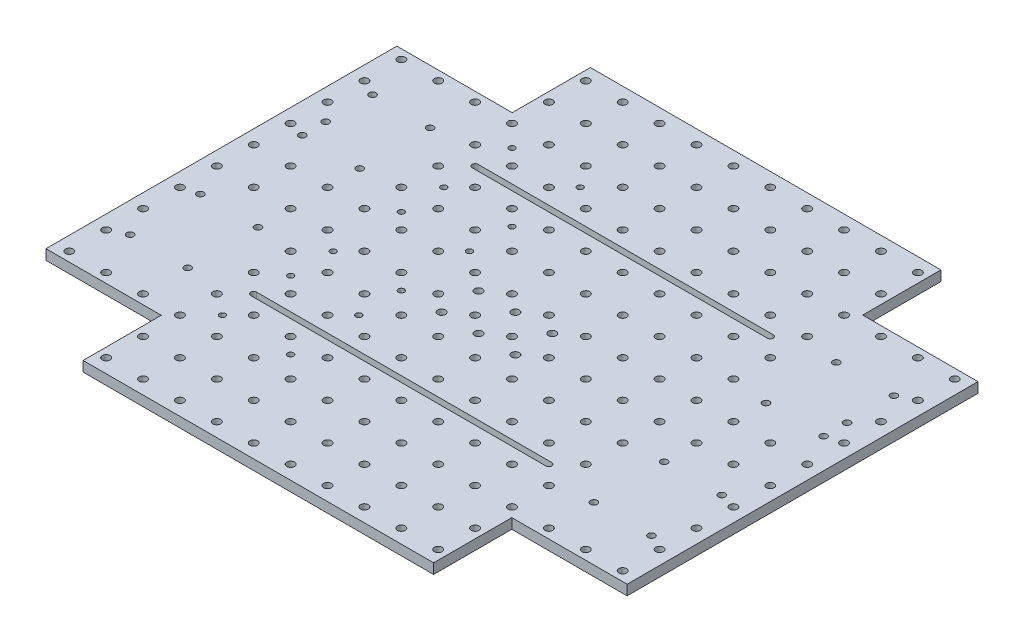
from build123d import *

# Parameters (mm, degrees)
BOSS_EXTRUDE1_DEPTH             = 5.4864
SKETCH2_R                       = 2.1
CUT_EXTRUDE1_DEPTH              = 210.1473179
F_3_0MM_CLEARANCE_DOWEL_HOLE1_D = 3.7
SKETCH5_R                       = 2.1
CUT_EXTRUDE2_DEPTH              = 210.1473179
CUT_EXTRUDE3_DEPTH              = 210.1473179
SKETCH7_R                       = 1.6
CUT_EXTRUDE4_DEPTH              = 210.1473179


with BuildPart() as part:
    # Sketch1 → Boss-Extrude1 (new body)
    with BuildSketch(Plane(origin=(0, 0, 0), x_dir=(1, 0, 0), z_dir=(0, 1, 0))):
        Polygon((95, -95.1), (157.5, -95.1), (157.5, 95.1), (95, 95.1), (95, 137.5), (-95, 137.5), (-95, 95.1), (-157.5, 95.1), (-157.5, -95.1), (-95, -95.1), (-95, -137.5), (95, -137.5), align=None)
    extrude(amount=BOSS_EXTRUDE1_DEPTH)

    # Sketch2 → Cut-Extrude1 (cut, through all)
    with BuildSketch(Plane(origin=(0, 5.4864, 0), x_dir=(1, 0, 0), z_dir=(0, 1, 0))):
        with Locations((90, -130)):
            Circle(SKETCH2_R)
        with Locations((70, -130)):
            Circle(SKETCH2_R)
        with Locations((50, -130)):
            Circle(SKETCH2_R)
        with Locations((30, -130)):
            Circle(SKETCH2_R)
        with Locations((10, -130)):
            Circle(SKETCH2_R)
        with Locations((-10, -130)):
            Circle(SKETCH2_R)
        with Locations((-30, -130)):
            Circle(SKETCH2_R)
        with Locations((-50, -130)):
            Circle(SKETCH2_R)
        with Locations((-70, -130)):
            Circle(SKETCH2_R)
        with Locations((-90, -130)):
            Circle(SKETCH2_R)
        with Locations((-110, -130)):
            Circle(SKETCH2_R)
        with Locations((90, -110)):
            Circle(SKETCH2_R)
        with Locations((70, -110)):
            Circle(SKETCH2_R)
        with Locations((50, -110)):
            Circle(SKETCH2_R)
        with Locations((30, -110)):
            Circle(SKETCH2_R)
        with Locations((10, -110)):
            Circle(SKETCH2_R)
        with Locations((-10, -110)):
            Circle(SKETCH2_R)
        with Locations((-30, -110)):
            Circle(SKETCH2_R)
        with Locations((-50, -110)):
            Circle(SKETCH2_R)
        with Locations((-70, -110)):
            Circle(SKETCH2_R)
        with Locations((-90, -110)):
            Circle(SKETCH2_R)
        with Locations((-110, -110)):
            Circle(SKETCH2_R)
        with Locations((150, -90)):
            Circle(SKETCH2_R)
        with Locations((130, -90)):
            Circle(SKETCH2_R)
        with Locations((110, -90)):
            Circle(SKETCH2_R)
        with Locations((90, -90)):
            Circle(SKETCH2_R)
        with Locations((70, -90)):
            Circle(SKETCH2_R)
        with Locations((50, -90)):
            Circle(SKETCH2_R)
        with Locations((30, -90)):
            Circle(SKETCH2_R)
        with Locations((10, -90)):
            Circle(SKETCH2_R)
        with Locations((-10, -90)):
            Circle(SKETCH2_R)
        with Locations((-30, -90)):
            Circle(SKETCH2_R)
        with Locations((-50, -90)):
            Circle(SKETCH2_R)
        with Locations((-70, -90)):
            Circle(SKETCH2_R)
        with Locations((-90, -90)):
            Circle(SKETCH2_R)
        with Locations((-110, -90)):
            Circle(SKETCH2_R)
        with Locations((-130, -90)):
            Circle(SKETCH2_R)
        with Locations((-150, -90)):
            Circle(SKETCH2_R)
        with Locations((150, -70)):
            Circle(SKETCH2_R)
        with Locations((90, -70)):
            Circle(SKETCH2_R)
        with Locations((70, -70)):
            Circle(SKETCH2_R)
        with Locations((50, -70)):
            Circle(SKETCH2_R)
        with Locations((30, -70)):
            Circle(SKETCH2_R)
        with Locations((10, -70)):
            Circle(SKETCH2_R)
        with Locations((-10, -70)):
            Circle(SKETCH2_R)
        with Locations((-30, -70)):
            Circle(SKETCH2_R)
        with Locations((-50, -70)):
            Circle(SKETCH2_R)
        with Locations((-70, -70)):
            Circle(SKETCH2_R)
        with Locations((-90, -70)):
            Circle(SKETCH2_R)
        with Locations((-150, -70)):
            Circle(SKETCH2_R)
        with Locations((150, -50)):
            Circle(SKETCH2_R)
        with Locations((90, -50)):
            Circle(SKETCH2_R)
        with Locations((70, -50)):
            Circle(SKETCH2_R)
        with Locations((50, -50)):
            Circle(SKETCH2_R)
        with Locations((30, -50)):
            Circle(SKETCH2_R)
        with Locations((10, -50)):
            Circle(SKETCH2_R)
        with Locations((-10, -50)):
            Circle(SKETCH2_R)
        with Locations((-30, -50)):
            Circle(SKETCH2_R)
        with Locations((-50, -50)):
            Circle(SKETCH2_R)
        with Locations((-70, -50)):
            Circle(SKETCH2_R)
        with Locations((-90, -50)):
            Circle(SKETCH2_R)
        with Locations((-150, -50)):
            Circle(SKETCH2_R)
        with Locations((150, -30)):
            Circle(SKETCH2_R)
        with Locations((90, -30)):
            Circle(SKETCH2_R)
        with Locations((70, -30)):
            Circle(SKETCH2_R)
        with Locations((50, -30)):
            Circle(SKETCH2_R)
        with Locations((30, -30)):
            Circle(SKETCH2_R)
        with Locations((10, -30)):
            Circle(SKETCH2_R)
        with Locations((-10, -30)):
            Circle(SKETCH2_R)
        with Locations((-30, -30)):
            Circle(SKETCH2_R)
        with Locations((-50, -30)):
            Circle(SKETCH2_R)
        with Locations((-70, -30)):
            Circle(SKETCH2_R)
        with Locations((-90, -30)):
            Circle(SKETCH2_R)
        with Locations((-150, -30)):
            Circle(SKETCH2_R)
        with Locations((150, -10)):
            Circle(SKETCH2_R)
        with Locations((130, -10)):
            Circle(SKETCH2_R)
        with Locations((110, -10)):
            Circle(SKETCH2_R)
        with Locations((90, -10)):
            Circle(SKETCH2_R)
        with Locations((70, -10)):
            Circle(SKETCH2_R)
        with Locations((50, -10)):
            Circle(SKETCH2_R)
        with Locations((30, -10)):
            Circle(SKETCH2_R)
        with Locations((10, -10)):
            Circle(SKETCH2_R)
        with Locations((-10, -10)):
            Circle(SKETCH2_R)
        with Locations((-30, -10)):
            Circle(SKETCH2_R)
        with Locations((-50, -10)):
            Circle(SKETCH2_R)
        with Locations((-70, -10)):
            Circle(SKETCH2_R)
        with Locations((-90, -10)):
            Circle(SKETCH2_R)
        with Locations((-110, -10)):
            Circle(SKETCH2_R)
        with Locations((-130, -10)):
            Circle(SKETCH2_R)
        with Locations((-150, -10)):
            Circle(SKETCH2_R)
        with Locations((150, 10)):
            Circle(SKETCH2_R)
        with Locations((130, 10)):
            Circle(SKETCH2_R)
        with Locations((110, 10)):
            Circle(SKETCH2_R)
        with Locations((90, 10)):
            Circle(SKETCH2_R)
        with Locations((70, 10)):
            Circle(SKETCH2_R)
        with Locations((50, 10)):
            Circle(SKETCH2_R)
        with Locations((30, 10)):
            Circle(SKETCH2_R)
        with Locations((10, 10)):
            Circle(SKETCH2_R)
        with Locations((-10, 10)):
            Circle(SKETCH2_R)
        with Locations((-30, 10)):
            Circle(SKETCH2_R)
        with Locations((-50, 10)):
            Circle(SKETCH2_R)
        with Locations((-70, 10)):
            Circle(SKETCH2_R)
        with Locations((-90, 10)):
            Circle(SKETCH2_R)
        with Locations((-110, 10)):
            Circle(SKETCH2_R)
        with Locations((-130, 10)):
            Circle(SKETCH2_R)
        with Locations((-150, 10)):
            Circle(SKETCH2_R)
        with Locations((150, 30)):
            Circle(SKETCH2_R)
        with Locations((90, 30)):
            Circle(SKETCH2_R)
        with Locations((70, 30)):
            Circle(SKETCH2_R)
        with Locations((50, 30)):
            Circle(SKETCH2_R)
        with Locations((30, 30)):
            Circle(SKETCH2_R)
        with Locations((10, 30)):
            Circle(SKETCH2_R)
        with Locations((-10, 30)):
            Circle(SKETCH2_R)
        with Locations((-30, 30)):
            Circle(SKETCH2_R)
        with Locations((-50, 30)):
            Circle(SKETCH2_R)
        with Locations((-70, 30)):
            Circle(SKETCH2_R)
        with Locations((-90, 30)):
            Circle(SKETCH2_R)
        with Locations((-150, 30)):
            Circle(SKETCH2_R)
        with Locations((150, 50)):
            Circle(SKETCH2_R)
        with Locations((90, 50)):
            Circle(SKETCH2_R)
        with Locations((70, 50)):
            Circle(SKETCH2_R)
        with Locations((50, 50)):
            Circle(SKETCH2_R)
        with Locations((30, 50)):
            Circle(SKETCH2_R)
        with Locations((10, 50)):
            Circle(SKETCH2_R)
        with Locations((-10, 50)):
            Circle(SKETCH2_R)
        with Locations((-30, 50)):
            Circle(SKETCH2_R)
        with Locations((-50, 50)):
            Circle(SKETCH2_R)
        with Locations((-70, 50)):
            Circle(SKETCH2_R)
        with Locations((-90, 50)):
            Circle(SKETCH2_R)
        with Locations((-150, 50)):
            Circle(SKETCH2_R)
        with Locations((150, 70)):
            Circle(SKETCH2_R)
        with Locations((90, 70)):
            Circle(SKETCH2_R)
        with Locations((70, 70)):
            Circle(SKETCH2_R)
        with Locations((50, 70)):
            Circle(SKETCH2_R)
        with Locations((30, 70)):
            Circle(SKETCH2_R)
        with Locations((10, 70)):
            Circle(SKETCH2_R)
        with Locations((-10, 70)):
            Circle(SKETCH2_R)
        with Locations((-30, 70)):
            Circle(SKETCH2_R)
        with Locations((-50, 70)):
            Circle(SKETCH2_R)
        with Locations((-70, 70)):
            Circle(SKETCH2_R)
        with Locations((-90, 70)):
            Circle(SKETCH2_R)
        with Locations((-150, 70)):
            Circle(SKETCH2_R)
        with Locations((150, 90)):
            Circle(SKETCH2_R)
        with Locations((130, 90)):
            Circle(SKETCH2_R)
        with Locations((110, 90)):
            Circle(SKETCH2_R)
        with Locations((90, 90)):
            Circle(SKETCH2_R)
        with Locations((70, 90)):
            Circle(SKETCH2_R)
        with Locations((50, 90)):
            Circle(SKETCH2_R)
        with Locations((30, 90)):
            Circle(SKETCH2_R)
        with Locations((10, 90)):
            Circle(SKETCH2_R)
        with Locations((-10, 90)):
            Circle(SKETCH2_R)
        with Locations((-30, 90)):
            Circle(SKETCH2_R)
        with Locations((-50, 90)):
            Circle(SKETCH2_R)
        with Locations((-70, 90)):
            Circle(SKETCH2_R)
        with Locations((-90, 90)):
            Circle(SKETCH2_R)
        with Locations((-110, 90)):
            Circle(SKETCH2_R)
        with Locations((-130, 90)):
            Circle(SKETCH2_R)
        with Locations((-150, 90)):
            Circle(SKETCH2_R)
        with Locations((150, 110)):
            Circle(SKETCH2_R)
        with Locations((130, 110)):
            Circle(SKETCH2_R)
        with Locations((110, 110)):
            Circle(SKETCH2_R)
        with Locations((90, 110)):
            Circle(SKETCH2_R)
        with Locations((70, 110)):
            Circle(SKETCH2_R)
        with Locations((50, 110)):
            Circle(SKETCH2_R)
        with Locations((30, 110)):
            Circle(SKETCH2_R)
        with Locations((10, 110)):
            Circle(SKETCH2_R)
        with Locations((-10, 110)):
            Circle(SKETCH2_R)
        with Locations((-30, 110)):
            Circle(SKETCH2_R)
        with Locations((-50, 110)):
            Circle(SKETCH2_R)
        with Locations((-70, 110)):
            Circle(SKETCH2_R)
        with Locations((-90, 110)):
            Circle(SKETCH2_R)
        with Locations((-110, 110)):
            Circle(SKETCH2_R)
        with Locations((-130, 110)):
            Circle(SKETCH2_R)
        with Locations((-150, 110)):
            Circle(SKETCH2_R)
        with Locations((110, 130)):
            Circle(SKETCH2_R)
        with Locations((90, 130)):
            Circle(SKETCH2_R)
        with Locations((70, 130)):
            Circle(SKETCH2_R)
        with Locations((50, 130)):
            Circle(SKETCH2_R)
        with Locations((30, 130)):
            Circle(SKETCH2_R)
        with Locations((10, 130)):
            Circle(SKETCH2_R)
        with Locations((-10, 130)):
            Circle(SKETCH2_R)
        with Locations((-30, 130)):
            Circle(SKETCH2_R)
        with Locations((-50, 130)):
            Circle(SKETCH2_R)
        with Locations((-70, 130)):
            Circle(SKETCH2_R)
        with Locations((-90, 130)):
            Circle(SKETCH2_R)
        with Locations((-110, 130)):
            Circle(SKETCH2_R)
        with Locations((90, 150)):
            Circle(SKETCH2_R)
        with Locations((70, 150)):
            Circle(SKETCH2_R)
        with Locations((50, 150)):
            Circle(SKETCH2_R)
        with Locations((30, 150)):
            Circle(SKETCH2_R)
        with Locations((10, 150)):
            Circle(SKETCH2_R)
        with Locations((-10, 150)):
            Circle(SKETCH2_R)
        with Locations((-30, 150)):
            Circle(SKETCH2_R)
        with Locations((-50, 150)):
            Circle(SKETCH2_R)
        with Locations((-70, 150)):
            Circle(SKETCH2_R)
        with Locations((-90, 150)):
            Circle(SKETCH2_R)
        with Locations((-110, 150)):
            Circle(SKETCH2_R)
    extrude(amount=-CUT_EXTRUDE1_DEPTH, mode=Mode.SUBTRACT)

    # Ø3.0mm Clearance Dowel Hole1 (through all)
    with Locations(Plane(origin=(-115.856739121, 5.4864, -238.740763972), x_dir=(1, 0, 0), z_dir=(0, 1, 0))):
        with Locations((-25.443260879, -173.040763972), (5.756739121, -173.040763972), (-25.443260879, -211.140763972), (5.756739121, -211.140763972), (225.956739121, -173.040763972), (257.156739121, -173.040763972), (225.956739121, -211.140763972), (257.156739121, -211.140763972), (225.956739121, -304.440763972), (225.956739121, -266.340763972), (257.156739121, -266.340763972), (257.156739121, -304.440763972), (-25.443260879, -266.340763972), (-25.443260879, -304.440763972), (5.756739121, -304.440763972), (5.756739121, -266.340763972), (-25.443260879, -198.440763972), (257.156739121, -198.440763972)):
            Hole(F_3_0MM_CLEARANCE_DOWEL_HOLE1_D / 2)

    # Sketch5 → Cut-Extrude2 (cut, through all)
    with BuildSketch(Plane(origin=(0, 5.4864, 0), x_dir=(1, 0, 0), z_dir=(0, 1, 0))):
        with Locations((-20.47, 2.3)):
            Circle(SKETCH5_R)
        with Locations((-0.47, 2.3)):
            Circle(SKETCH5_R)
        with Locations((19.53, 2.3)):
            Circle(SKETCH5_R)
        with Locations((-20.47, -17.7)):
            Circle(SKETCH5_R)
        with Locations((-0.47, -17.7)):
            Circle(SKETCH5_R)
        with Locations((19.53, -17.7)):
            Circle(SKETCH5_R)
    extrude(amount=-CUT_EXTRUDE2_DEPTH, mode=Mode.SUBTRACT)

    # Sketch6 → Cut-Extrude3 (cut, through all)
    with BuildSketch(Plane(origin=(0, 5.4864, 0), x_dir=(1, 0, 0), z_dir=(0, 1, 0))):
        with BuildLine():
            Line((-80, 61.6), (80, 61.6))
            ThreePointArc((80, 61.6), (81.6, 60), (80, 58.4))
            Line((80, 58.4), (-80, 58.4))
            ThreePointArc((-80, 58.4), (-81.6, 60), (-80, 61.6))
        make_face()
        with BuildLine():
            Line((-80, -58.4), (80, -58.4))
            ThreePointArc((80, -58.4), (81.6, -60), (80, -61.6))
            Line((80, -61.6), (-80, -61.6))
            ThreePointArc((-80, -61.6), (-81.6, -60), (-80, -58.4))
        make_face()
    extrude(amount=-CUT_EXTRUDE3_DEPTH, mode=Mode.SUBTRACT)

    # Sketch7 → Cut-Extrude4 (cut, through all)
    with BuildSketch(Plane(origin=(0, 5.4864, 0), x_dir=(1, 0, 0), z_dir=(0, 1, 0))):
        with Locations((-78.475, 18.475)):
            Circle(SKETCH7_R)
        with Locations((-78.475, -18.475)):
            Circle(SKETCH7_R)
        with Locations((-41.525, -18.475)):
            Circle(SKETCH7_R)
        with Locations((-41.525, 18.475)):
            Circle(SKETCH7_R)
        with Locations((-78.475, 78.475)):
            Circle(SKETCH7_R)
        with Locations((-78.475, 41.525)):
            Circle(SKETCH7_R)
        with Locations((-41.525, 41.525)):
            Circle(SKETCH7_R)
        with Locations((-41.525, 78.475)):
            Circle(SKETCH7_R)
        with Locations((-78.475, -41.525)):
            Circle(SKETCH7_R)
        with Locations((-78.475, -78.475)):
            Circle(SKETCH7_R)
        with Locations((-41.525, -78.475)):
            Circle(SKETCH7_R)
        with Locations((-41.525, -41.525)):
            Circle(SKETCH7_R)
    extrude(amount=-CUT_EXTRUDE4_DEPTH, mode=Mode.SUBTRACT)


solid = part.part
